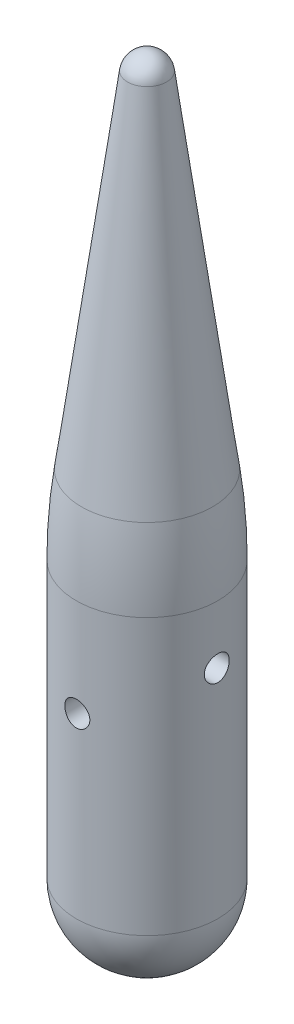
from build123d import *

# Parameters (mm, degrees)
SKETCH3_R               = 6.35
CUT_EXTRUDE1_DEPTH      = 50
CUT_EXTRUDE2_DEPTH      = 202.61349163
CUT_EXTRUDE2_DEPTH_BACK = 202.61349163
SKETCH4_R               = 3.175
CUT_EXTRUDE3_DEPTH      = 202.61349163
CUT_EXTRUDE3_DEPTH_BACK = 10
SKETCH5_R               = 3.175


with BuildPart() as part:
    # Sketch2 → Revolve1 (revolve)
    with BuildSketch(Plane.YZ):
        with BuildLine():
            Line((0, 0), (200, 0))
            ThreePointArc((200, 0), (198.7623899, 3.293087038), (195.662231104, 4.955950965))
            Line((195.662231104, 4.955950965), (108, 16.669677852))
            ThreePointArc((108, 16.669677852), (98.022097548, 17.667052408), (88, 18))
            Line((88, 18), (18, 18))
            ThreePointArc((18, 18), (5.272077939, 12.727922061), (0, 0))
        make_face()
    revolve(axis=Axis((0, 0, 0), (0, 1, 0)))

    # Sketch3 → Cut-Extrude1 (cut)
    with BuildSketch(Plane(origin=(0, 0, 0), x_dir=(-1, 0, 0), z_dir=(0, 1, 0))):
        Circle(SKETCH3_R)
    extrude(amount=CUT_EXTRUDE1_DEPTH, mode=Mode.SUBTRACT)

    # Sketch4 → Cut-Extrude2 (cut, two sides: drawn at the far end of the back side and taken through both)
    with BuildSketch(Plane.YZ.offset(-CUT_EXTRUDE2_DEPTH_BACK)):
        with Locations((73.175, 0)):
            Circle(SKETCH4_R)
    extrude(amount=CUT_EXTRUDE2_DEPTH + CUT_EXTRUDE2_DEPTH_BACK, mode=Mode.SUBTRACT)

    # Sketch5 → Cut-Extrude3 (cut, two sides: drawn at the far end of the back side and taken through both)
    with BuildSketch(Plane(origin=(0, 0, 0), x_dir=(0, 1, 0), z_dir=(0, 0, 1)).offset(-CUT_EXTRUDE3_DEPTH_BACK)):
        with Locations((63.175, 0)):
            Circle(SKETCH5_R)
    extrude(amount=CUT_EXTRUDE3_DEPTH + CUT_EXTRUDE3_DEPTH_BACK, mode=Mode.SUBTRACT)


solid = part.part
